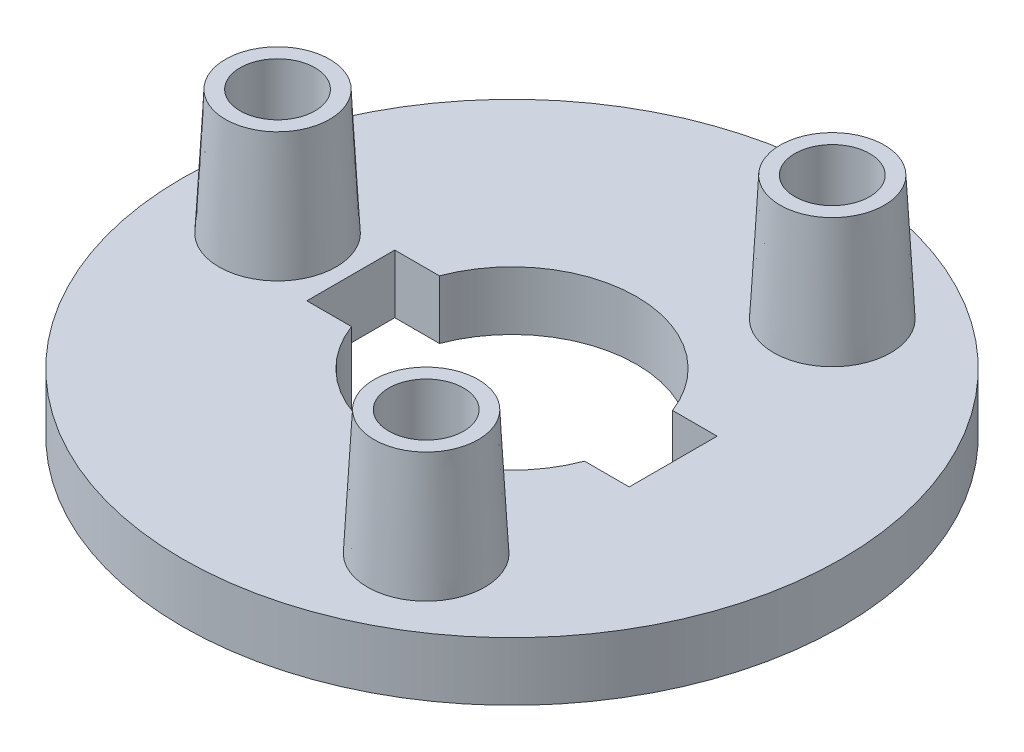
from build123d import *

# Parameters (mm, degrees)
ESQUISSE1_R                                 = 22.5
BOSS_EXTRU_1_DEPTH                          = 4
ESQUISSE2_R                                 = 4
BOSS_EXTRU_3_DEPTH                          = 8.5
CHANFREIN1_SIZE                             = 8.5
CHANFREIN1_SIZE_2                           = 0.445466124
ESQUISSE4_R                                 = 2.554533876
ENL_V_MAT_EXTRU_1_DEPTH                     = 35.186985828
R_P_TITION_CIRCULAIRE1_COUNT                = 3
CHANFREIN1_OF_R_P_TITION_CIRCULAIRE1_SIZE   = 8.5
CHANFREIN1_OF_R_P_TITION_CIRCULAIRE1_SIZE_2 = 0.445466124
ENL_V_MAT_EXTRU_2_REACH                     = 34.936
ESQUISSE5_R                                 = 8.5
ENL_V_START                                 = -4
ESQUISSE6_W                                 = 22
ESQUISSE6_H                                 = 6
ENL_V_MAT_EXTRU_4_DEPTH                     = 4
BOSS_EXTRU_5_DEPTH                          = 8
ESQUISSE8_W                                 = 3.05
ESQUISSE8_H                                 = 3
BOSS_EXTRU_6_DEPTH                          = 5
R_P_TITION_CIRCULAIRE3_COUNT                = 2


with BuildPart() as part:
    # Esquisse1 → Boss.-Extru.1 (new body)
    with BuildSketch(Plane(origin=(0, 0, 0), x_dir=(1, 0, 0), z_dir=(0, 1, 0))):
        with Locations(Location((0, 0, 0), (0, 0, 270))):
            Circle(ESQUISSE1_R)
    extrude(amount=BOSS_EXTRU_1_DEPTH)

    # Esquisse2 → Boss.-Extru.3 (add)
    with BuildSketch(Plane(origin=(0, 4, 0), x_dir=(1, 0, 0), z_dir=(0, 1, 0))):
        with Locations(Location((-16, 0, 0), (0, 0, 270))):
            Circle(ESQUISSE2_R)
    boss_extru_3 = extrude(amount=BOSS_EXTRU_3_DEPTH)

    # Chanfrein1
    # the kernel refuses this chamfer: 8.5, 0.445466124 mm, written as the material it takes off along each edge
    with BuildSketch(Plane(origin=(-16, 12.5, 0), x_dir=(0, 0, 1), z_dir=(-1, 0, 0))) as chanfrein1_piece_1_section:
        Polygon((4, -CHANFREIN1_SIZE), (4 - CHANFREIN1_SIZE_2, 0), (4, 0), align=None)
    chanfrein1_piece_1 = revolve(axis=Axis((-16, 12.5, 0), (0, 1, 0)), mode=Mode.PRIVATE)
    chanfrein1_piece_1 = split(chanfrein1_piece_1, bisect_by=Plane(origin=(-16, 4, -3.812448858), z_dir=(0, 1, 0)), keep=Keep.TOP, mode=Mode.PRIVATE)
    add(chanfrein1_piece_1, mode=Mode.SUBTRACT)

    # Esquisse4 → Enlèv. mat.-Extru.1 (cut, through all)
    with BuildSketch(Plane(origin=(0, 12.5, 0), x_dir=(1, 0, 0), z_dir=(0, 1, 0))):
        with Locations(Location((-16, 0, 0), (0, 0, 270))):
            Circle(ESQUISSE4_R)
    enl_v_mat_extru_1 = extrude(amount=-ENL_V_MAT_EXTRU_1_DEPTH, mode=Mode.SUBTRACT)

    # Répétition circulaire1: Boss.-Extru.3, Enlèv. mat.-Extru.1 ×3 about axis
    r_p_tition_circulaire1_axis = Axis((0, 0, 0), (0, 1, 0))
    add([boss_extru_3.rotate(r_p_tition_circulaire1_axis, i * 360 / R_P_TITION_CIRCULAIRE1_COUNT) for i in range(1, R_P_TITION_CIRCULAIRE1_COUNT)])
    add([enl_v_mat_extru_1.rotate(r_p_tition_circulaire1_axis, i * 360 / R_P_TITION_CIRCULAIRE1_COUNT) for i in range(1, R_P_TITION_CIRCULAIRE1_COUNT)], mode=Mode.SUBTRACT)

    # Chanfrein1 of Répétition circulaire1
    # the kernel refuses this chamfer: 8.5, 0.445466124 mm, written as the material it takes off along each edge
    with BuildSketch(Plane(origin=(8, 12.5, 13.856406461), x_dir=(0.8660254037844387, 0, -0.5000000000000001), z_dir=(0.5000000000000001, 0, 0.8660254037844387))) as chanfrein1_of_r_p_tition_circulaire1_piece_1_section:
        Polygon((4, -CHANFREIN1_OF_R_P_TITION_CIRCULAIRE1_SIZE), (4 - CHANFREIN1_OF_R_P_TITION_CIRCULAIRE1_SIZE_2, 0), (4, 0), align=None)
    chanfrein1_of_r_p_tition_circulaire1_piece_1 = revolve(axis=Axis((8, 12.5, 13.856406461), (0, 1, 0)), mode=Mode.PRIVATE)
    chanfrein1_of_r_p_tition_circulaire1_piece_1 = split(chanfrein1_of_r_p_tition_circulaire1_piece_1, bisect_by=Plane(origin=(4.698322438, 4, 15.762630889), z_dir=(0, 1, 0)), keep=Keep.TOP, mode=Mode.PRIVATE)
    add(chanfrein1_of_r_p_tition_circulaire1_piece_1, mode=Mode.SUBTRACT)
    with BuildSketch(Plane(origin=(8, 12.5, -13.856406461), x_dir=(-0.8660254037844384, 0, -0.5000000000000003), z_dir=(0.5000000000000003, 0, -0.8660254037844384))) as chanfrein1_of_r_p_tition_circulaire1_piece_2_section:
        Polygon((4, -CHANFREIN1_OF_R_P_TITION_CIRCULAIRE1_SIZE), (4 - CHANFREIN1_OF_R_P_TITION_CIRCULAIRE1_SIZE_2, 0), (4, 0), align=None)
    chanfrein1_of_r_p_tition_circulaire1_piece_2 = revolve(axis=Axis((8, 12.5, -13.856406461), (0, 1, 0)), mode=Mode.PRIVATE)
    chanfrein1_of_r_p_tition_circulaire1_piece_2 = split(chanfrein1_of_r_p_tition_circulaire1_piece_2, bisect_by=Plane(origin=(11.301677562, 4, -11.950182032), z_dir=(0, 1, 0)), keep=Keep.TOP, mode=Mode.PRIVATE)
    add(chanfrein1_of_r_p_tition_circulaire1_piece_2, mode=Mode.SUBTRACT)

    # Esquisse5 → Enlèv. mat.-Extru.2 (cut, up to next)
    with BuildSketch(Plane(origin=(0, 4, 0), x_dir=(1, 0, 0), z_dir=(0, 1, 0)), mode=Mode.PRIVATE) as enl_v_mat_extru_2_sk1:
        with Locations(Location((0, 0, 0), (0, 0, 270))):
            Circle(ESQUISSE5_R)
    enl_v_mat_extru_2_tool1 = extrude(enl_v_mat_extru_2_sk1.sketch, amount=-ENL_V_MAT_EXTRU_2_REACH, mode=Mode.PRIVATE) & part.part
    add(enl_v_mat_extru_2_tool1.solids().sort_by_distance((0, 4, 0))[0], mode=Mode.SUBTRACT)

    # Esquisse6 → Enlèv. mat.-Extru.4 (cut)
    with BuildSketch(Plane(origin=(0, 4, 0), x_dir=(1, 0, 0), z_dir=(0, 1, 0)).offset(ENL_V_START)):
        Rectangle(ESQUISSE6_W, ESQUISSE6_H)
    extrude(amount=ENL_V_MAT_EXTRU_4_DEPTH, mode=Mode.SUBTRACT)

    # Esquisse7 → Boss.-Extru.5 (add)
    with BuildSketch(Plane(origin=(0, 0, 0), x_dir=(1, 0, 0), z_dir=(0, 1, 0))):
        with BuildLine():
            Line((-7.95298686, -3), (-11, -3))
            ThreePointArc((-11, -3), (-10.201314207, -6.051828113), (-8.010041275, -8.321162104))
            Line((-8.010041275, -8.321162104), (-5.894835571, -6.123798951))
            ThreePointArc((-5.894835571, -6.123798951), (-7.097892398, -4.676529002), (-7.95298686, -3))
        make_face()
    boss_extru_5 = extrude(amount=-BOSS_EXTRU_5_DEPTH)

    # Esquisse8 → Boss.-Extru.6 (add)
    with BuildSketch(Plane(origin=(0, 0, 0), x_dir=(0.6935100671316063, 0, -0.7204469354415458), z_dir=(0.7204469354415458, 0, 0.6935100671316063))):
        with Locations((-10.025, -6.5)):
            Rectangle(ESQUISSE8_W, ESQUISSE8_H)
    boss_extru_6 = extrude(amount=BOSS_EXTRU_6_DEPTH)

    # Répétition circulaire3: Boss.-Extru.5, Boss.-Extru.6 ×2 about axis
    r_p_tition_circulaire3_axis = Axis((0, 0, 0), (0, 1, 0))
    add([boss_extru_5.rotate(r_p_tition_circulaire3_axis, i * 360 / R_P_TITION_CIRCULAIRE3_COUNT) for i in range(1, R_P_TITION_CIRCULAIRE3_COUNT)])
    add([boss_extru_6.rotate(r_p_tition_circulaire3_axis, i * 360 / R_P_TITION_CIRCULAIRE3_COUNT) for i in range(1, R_P_TITION_CIRCULAIRE3_COUNT)])


solid = part.part
